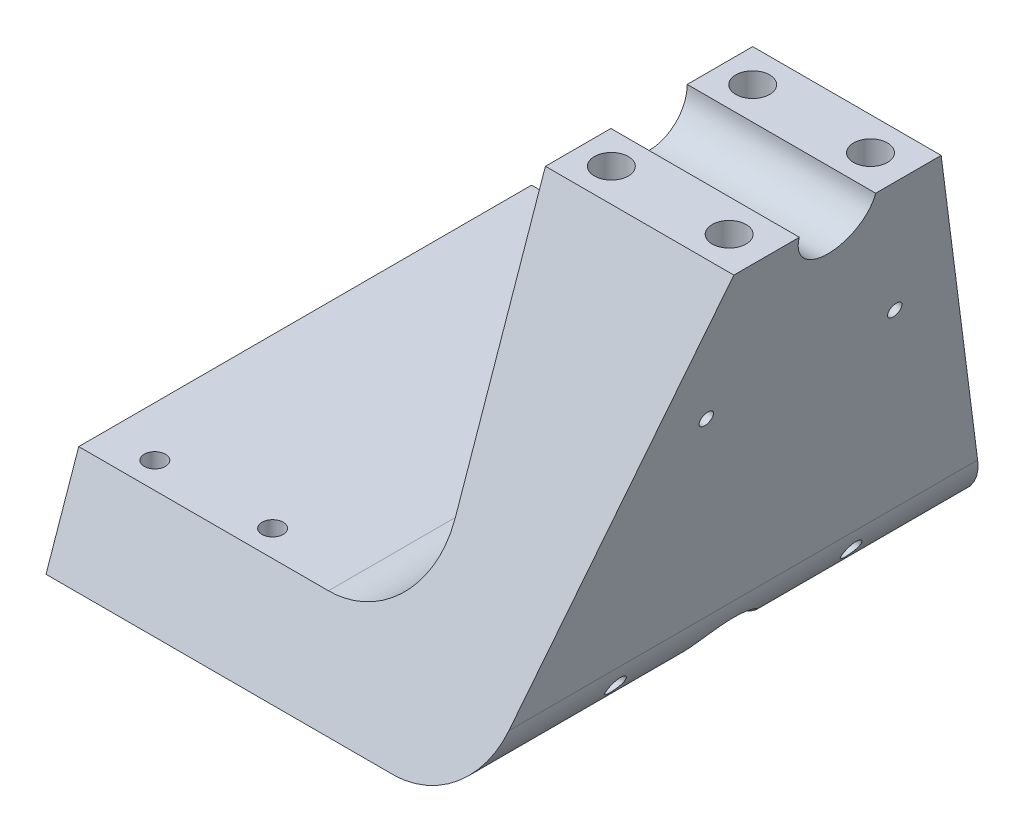
from build123d import *

# Parameters (mm, degrees)
BOSS_EXTRUDE1_DEPTH     = 110
SKETCH2_R               = 8.1
CUT_EXTRUDE1_DEPTH      = 160.899233532
CUT_EXTRUDE2_DEPTH      = 163.646856717
CUT_EXTRUDE2_DEPTH_BACK = 163.646856717
SKETCH3_R               = 2.25
CUT_EXTRUDE3_DEPTH      = 152.835437234
SKETCH5_R               = 3.6
CUT_EXTRUDE4_DEPTH      = 17
SKETCH6_R               = 10
SKETCH6_R_2             = 2
CUT_EXTRUDE5_DEPTH      = 149
SKETCH7_R               = 1.5
CUT_EXTRUDE6_DEPTH      = 43


with BuildPart() as part:
    # Sketch1 → Boss-Extrude1 (new body)
    with BuildSketch(Plane.XY):
        with BuildLine():
            Line((0, 0), (40, 0))
            Line((40, 0), (20, -79.858784278))
            ThreePointArc((20, -79.858784278), (12.904134464, -90.766668728), (0.599169725, -95))
            Line((0.599169725, -95), (-73, -95))
            Line((-73, -95), (-73, -75))
            Line((-73, -75), (-20, -75))
            ThreePointArc((-20, -75), (-5.857864376, -69.142135624), (0, -55))
            Line((0, -55), (0, 0))
        make_face()
    extrude(amount=BOSS_EXTRUDE1_DEPTH)

    # Sketch2 → Cut-Extrude1 (cut, through all)
    with BuildSketch(Plane(origin=(0, -4.784896585, 0), x_dir=(0, 0, -1), z_dir=(1, 0, 0))):
        with Locations((-55, 4.784896585)):
            Circle(SKETCH2_R)
    extrude(amount=CUT_EXTRUDE1_DEPTH, mode=Mode.SUBTRACT)

    # Sketch4 → Cut-Extrude2 (cut, two sides: drawn at the far end of the back side and taken through both)
    with BuildSketch(Plane.ZY.offset(-CUT_EXTRUDE2_DEPTH_BACK)):
        Polygon((33, 0), (0, -95), (0, 0), align=None)
        Polygon((77, 0), (110, -95), (110, 0), align=None)
    extrude(amount=CUT_EXTRUDE2_DEPTH + CUT_EXTRUDE2_DEPTH_BACK, mode=Mode.SUBTRACT)

    # Sketch3 → Cut-Extrude3 (cut, through all)
    with BuildSketch(Plane(origin=(0, -75, 0), x_dir=(1, 0, 0), z_dir=(0, 1, 0))):
        with Locations((-62.4, -12.5)):
            Circle(SKETCH3_R)
        with Locations((-62.4, -97.5)):
            Circle(SKETCH3_R)
        with Locations((-37.4, -12.5)):
            Circle(SKETCH3_R)
        with Locations((-37.4, -97.5)):
            Circle(SKETCH3_R)
    extrude(amount=-CUT_EXTRUDE3_DEPTH, mode=Mode.SUBTRACT)

    # Sketch5 → Cut-Extrude4 (cut)
    with BuildSketch(Plane(origin=(0, 0, 0), x_dir=(1, 0, 0), z_dir=(0, 1, 0))):
        with Locations((7, -40)):
            Circle(SKETCH5_R)
        with Locations((32, -40)):
            Circle(SKETCH5_R)
        with Locations((7, -70)):
            Circle(SKETCH5_R)
        with Locations((32, -70)):
            Circle(SKETCH5_R)
    extrude(amount=-CUT_EXTRUDE4_DEPTH, mode=Mode.SUBTRACT)

    # Sketch6 → Cut-Extrude5 (cut)
    with BuildSketch(Plane.ZY.offset(73)):
        with Locations((55, -95)):
            Circle(SKETCH6_R)
        with Locations((30, -85)):
            Circle(SKETCH6_R_2)
        with Locations((80, -85)):
            Circle(SKETCH6_R_2)
    extrude(amount=-CUT_EXTRUDE5_DEPTH, mode=Mode.SUBTRACT)

    # Sketch7 → Cut-Extrude6 (cut)
    with BuildSketch(Plane(origin=(37.639221534, -9.426444911, 0), x_dir=(0, 0, -1), z_dir=(0.9700415137276943, -0.24293921388874956, 0))):
        with Locations((-75, -22.607551707)):
            Circle(SKETCH7_R)
        with Locations((-35, -22.607551707)):
            Circle(SKETCH7_R)
    extrude(amount=-CUT_EXTRUDE6_DEPTH, mode=Mode.SUBTRACT)


solid = part.part
